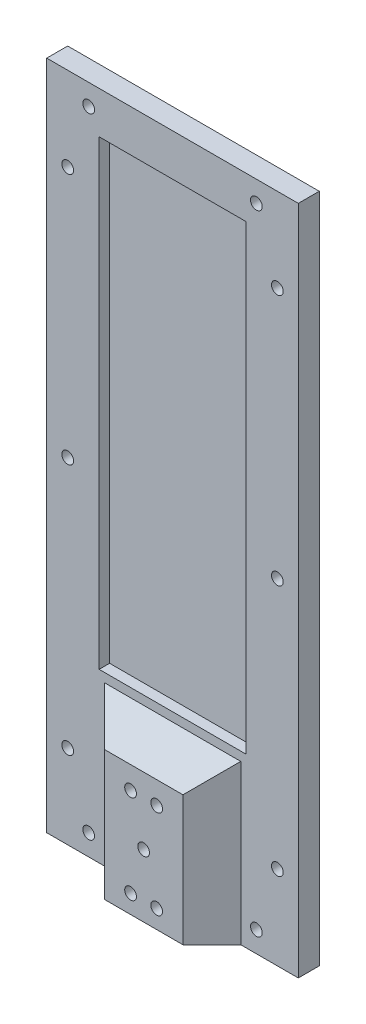
from build123d import *

# Parameters (mm, degrees)
SKETCH1_W           = 76.2
SKETCH1_H           = 203.2
BOSS_EXTRUDE1_DEPTH = 6.35
SKETCH6_R           = 1.778
CUT_EXTRUDE4_DEPTH  = 6.35
SKETCH7_W           = 21.336
SKETCH7_H           = 38.1
BOSS_EXTRUDE2_DEPTH = 8.754615714
SKETCH8_R           = 1.778
CUT_EXTRUDE5_DEPTH  = 218.542707108
SKETCH9_W           = 44.45
SKETCH9_H           = 139.7
CUT_EXTRUDE6_DEPTH  = 3.175
CHAMFER1_SIZE       = 10


with BuildPart() as part:
    # Sketch1 → Boss-Extrude1 (new body)
    with BuildSketch(Plane.XY):
        with Locations((38.1, 101.6)):
            Rectangle(SKETCH1_W, SKETCH1_H)
    extrude(amount=BOSS_EXTRUDE1_DEPTH)

    # Sketch6 → Cut-Extrude4 (cut)
    with BuildSketch(Plane(origin=(0, 0, 0), x_dir=(-1, 0, 0), z_dir=(0, 0, -1))):
        with Locations((-63.5, 6.35)):
            Circle(SKETCH6_R)
        with Locations((-12.7, 6.35)):
            Circle(SKETCH6_R)
        with Locations((-6.35, 177.8)):
            Circle(SKETCH6_R)
        with Locations((-6.35, 25.4)):
            Circle(SKETCH6_R)
        with Locations((-69.85, 25.4)):
            Circle(SKETCH6_R)
        with Locations((-69.85, 177.8)):
            Circle(SKETCH6_R)
        with Locations((-63.5, 196.85)):
            Circle(SKETCH6_R)
        with Locations((-12.7, 196.85)):
            Circle(SKETCH6_R)
        with Locations((-6.35, 101.6)):
            Circle(SKETCH6_R)
        with Locations((-69.85, 101.6)):
            Circle(SKETCH6_R)
    extrude(amount=-CUT_EXTRUDE4_DEPTH, mode=Mode.SUBTRACT)

    # Sketch7 → Boss-Extrude2 (add)
    with BuildSketch(Plane.XY.offset(6.35)):
        with Locations((38.1, 19.05)):
            Rectangle(SKETCH7_W, SKETCH7_H)
    extrude(amount=BOSS_EXTRUDE2_DEPTH)

    # Sketch8 → Cut-Extrude5 (cut, through all)
    with BuildSketch(Plane.XY.offset(15.104615714)):
        with Locations((34.1503, 5.5753)):
            Circle(SKETCH8_R)
        with Locations((42.0497, 5.5753)):
            Circle(SKETCH8_R)
        with Locations((42.0497, 32.5247)):
            Circle(SKETCH8_R)
        with Locations((34.1503, 32.5247)):
            Circle(SKETCH8_R)
        with Locations((38.1, 19.05)):
            Circle(SKETCH8_R)
    extrude(amount=-CUT_EXTRUDE5_DEPTH, mode=Mode.SUBTRACT)

    # Sketch9 → Cut-Extrude6 (cut)
    with BuildSketch(Plane.XY.offset(6.35)):
        with Locations((38.1, 120.65)):
            Rectangle(SKETCH9_W, SKETCH9_H)
    extrude(amount=-CUT_EXTRUDE6_DEPTH, mode=Mode.SUBTRACT)

    # Chamfer1
    # the kernel refuses this chamfer: 10 mm, written as the material it adds along each edge
    with BuildSketch(Plane(origin=(27.432, 38.1, 6.35), x_dir=(-0.9996219169112968, 0, -0.027495876610586403), z_dir=(0, -1, 0))) as chamfer1_piece_1_section:
        Polygon((CHAMFER1_SIZE * 0.999621916911, -CHAMFER1_SIZE * 0.0274958766106), (-CHAMFER1_SIZE * 0.0274958766106, -CHAMFER1_SIZE * 0.999621916911), (0, 0), align=None)
    chamfer1_piece_1 = extrude(amount=38.1, mode=Mode.PRIVATE)
    chamfer1_piece_1 = split(chamfer1_piece_1, bisect_by=Plane(origin=(24.052510744, 19.05, 15.104615714), z_dir=(0, 0, -1)), keep=Keep.TOP, mode=Mode.PRIVATE)
    add(chamfer1_piece_1)
    with BuildSketch(Plane(origin=(48.768, 38.1, 6.35), x_dir=(0, 0.9996219169112968, -0.027495876610586403), z_dir=(-1, 0, 0))) as chamfer1_piece_2_section:
        Polygon((CHAMFER1_SIZE * 0.999621916911, -CHAMFER1_SIZE * 0.0274958766106), (-CHAMFER1_SIZE * 0.0274958766106, -CHAMFER1_SIZE * 0.999621916911), (0, 0), align=None)
    chamfer1_piece_2 = extrude(amount=21.336, mode=Mode.PRIVATE)
    chamfer1_piece_2 = split(chamfer1_piece_2, bisect_by=Plane(origin=(38.1, 41.479489256, 15.104615714), z_dir=(0, 0, -1)), keep=Keep.TOP, mode=Mode.PRIVATE)
    add(chamfer1_piece_2)
    with BuildSketch(Plane(origin=(48.768, 0, 6.35), x_dir=(0.9996219169112968, 0, -0.027495876610586403), z_dir=(0, 1, 0))) as chamfer1_piece_3_section:
        Polygon((CHAMFER1_SIZE * 0.999621916911, -CHAMFER1_SIZE * 0.0274958766106), (-CHAMFER1_SIZE * 0.0274958766106, -CHAMFER1_SIZE * 0.999621916911), (0, 0), align=None)
    chamfer1_piece_3 = extrude(amount=38.1, mode=Mode.PRIVATE)
    chamfer1_piece_3 = split(chamfer1_piece_3, bisect_by=Plane(origin=(52.147489256, 19.05, 15.104615714), z_dir=(0, 0, -1)), keep=Keep.TOP, mode=Mode.PRIVATE)
    add(chamfer1_piece_3)
    with BuildSketch(Plane(origin=(27.432, 63.81682988, 6.35), x_dir=(-0.9996219169112968, 0, -0.027495876610586403), z_dir=(0, -1, 0))) as chamfer1_piece_4a_section:
        Polygon((CHAMFER1_SIZE * 0.999621916911, -CHAMFER1_SIZE * 0.0274958766106), (-CHAMFER1_SIZE * 0.0274958766106, -CHAMFER1_SIZE * 0.999621916911), (0, 0), align=None)
    chamfer1_piece_4a = extrude(amount=63.81682988, mode=Mode.PRIVATE)
    chamfer1_piece_4a = split(chamfer1_piece_4a, bisect_by=Plane(origin=(24.052510744, 50.8, 9.492641484), z_dir=(0, -1, 0)), keep=Keep.TOP, mode=Mode.PRIVATE)
    chamfer1_piece_4a = split(chamfer1_piece_4a, bisect_by=Plane(origin=(24.052510744, 38.1, 9.492641484), z_dir=(0, 1, 0)), keep=Keep.TOP, mode=Mode.PRIVATE)
    chamfer1_piece_4a = split(chamfer1_piece_4a, bisect_by=Plane(origin=(24.052510744, 44.45, 15.104615714), z_dir=(0, 0, -1)), keep=Keep.TOP, mode=Mode.PRIVATE)
    with BuildSketch(Plane(origin=(48.768, 38.1, 6.35), x_dir=(0, 0.9996219169112968, -0.027495876610586403), z_dir=(-1, 0, 0))) as chamfer1_piece_4b_section:
        Polygon((CHAMFER1_SIZE * 0.999621916911, -CHAMFER1_SIZE * 0.0274958766106), (-CHAMFER1_SIZE * 0.0274958766106, -CHAMFER1_SIZE * 0.999621916911), (0, 0), align=None)
    chamfer1_piece_4b = extrude(amount=47.05282988, mode=Mode.PRIVATE)
    chamfer1_piece_4b = split(chamfer1_piece_4b, bisect_by=Plane(origin=(27.432, 41.479489256, 9.492641484), z_dir=(-1, 0, 0)), keep=Keep.TOP, mode=Mode.PRIVATE)
    chamfer1_piece_4b = split(chamfer1_piece_4b, bisect_by=Plane(origin=(14.57358506, 41.479489256, 15.104615714), z_dir=(0, 0, -1)), keep=Keep.TOP, mode=Mode.PRIVATE)
    chamfer1_piece_4 = chamfer1_piece_4a & chamfer1_piece_4b
    add(chamfer1_piece_4)
    with BuildSketch(Plane(origin=(74.48482988, 38.1, 6.35), x_dir=(0, 0.9996219169112968, -0.027495876610586403), z_dir=(-1, 0, 0))) as chamfer1_piece_5a_section:
        Polygon((CHAMFER1_SIZE * 0.999621916911, -CHAMFER1_SIZE * 0.0274958766106), (-CHAMFER1_SIZE * 0.0274958766106, -CHAMFER1_SIZE * 0.999621916911), (0, 0), align=None)
    chamfer1_piece_5a = extrude(amount=47.05282988, mode=Mode.PRIVATE)
    chamfer1_piece_5a = split(chamfer1_piece_5a, bisect_by=Plane(origin=(61.62641494, 41.479489256, 15.104615714), z_dir=(0, 0, -1)), keep=Keep.TOP, mode=Mode.PRIVATE)
    chamfer1_piece_5a = split(chamfer1_piece_5a, bisect_by=Plane(origin=(48.768, 41.479489256, 9.492641484), z_dir=(1, 0, 0)), keep=Keep.TOP, mode=Mode.PRIVATE)
    with BuildSketch(Plane(origin=(48.768, 0, 6.35), x_dir=(0.9996219169112968, 0, -0.027495876610586403), z_dir=(0, 1, 0))) as chamfer1_piece_5b_section:
        Polygon((CHAMFER1_SIZE * 0.999621916911, -CHAMFER1_SIZE * 0.0274958766106), (-CHAMFER1_SIZE * 0.0274958766106, -CHAMFER1_SIZE * 0.999621916911), (0, 0), align=None)
    chamfer1_piece_5b = extrude(amount=63.81682988, mode=Mode.PRIVATE)
    chamfer1_piece_5b = split(chamfer1_piece_5b, bisect_by=Plane(origin=(52.147489256, 50.8, 9.492641484), z_dir=(0, -1, 0)), keep=Keep.TOP, mode=Mode.PRIVATE)
    chamfer1_piece_5b = split(chamfer1_piece_5b, bisect_by=Plane(origin=(52.147489256, 44.45, 15.104615714), z_dir=(0, 0, -1)), keep=Keep.TOP, mode=Mode.PRIVATE)
    chamfer1_piece_5b = split(chamfer1_piece_5b, bisect_by=Plane(origin=(52.147489256, 38.1, 9.492641484), z_dir=(0, 1, 0)), keep=Keep.TOP, mode=Mode.PRIVATE)
    chamfer1_piece_5 = chamfer1_piece_5a & chamfer1_piece_5b
    add(chamfer1_piece_5)


solid = part.part
